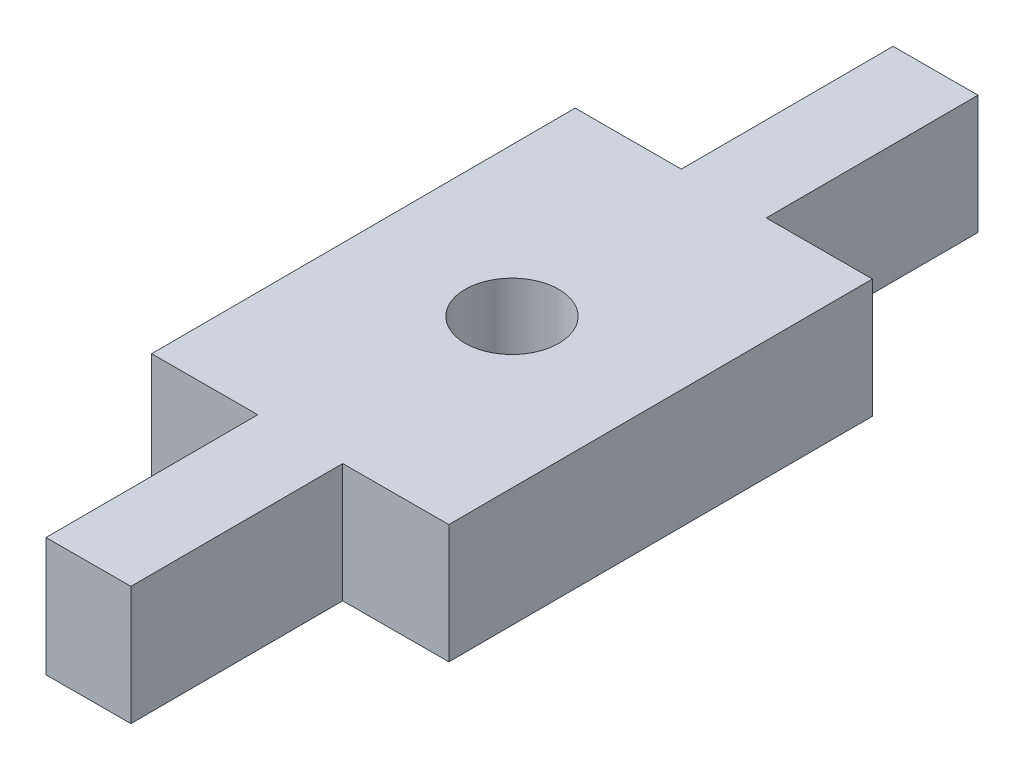
from build123d import *

# Parameters (mm, degrees)
SKETCH1_R           = 1.25
BOSS_EXTRUDE1_DEPTH = 3.175


with BuildPart() as part:
    # Sketch1 → Boss-Extrude1 (new body)
    with BuildSketch(Plane(origin=(0, 0, 0), x_dir=(1, 0, 0), z_dir=(0, 1, 0))):
        Polygon((-1.118043587, -5.668782879), (-1.105681336, -11.33506329), (1.156720386, -11.330127358), (1.144358255, -5.663902003), (3.972550508, -5.657731673), (3.947826292, 5.674698742), (1.119809509, 5.668528795), (1.1074474, 11.334744509), (-1.154834519, 11.329808838), (-1.14247241, 5.663592957), (-3.970788681, 5.657422357), (-3.946064585, -5.674952836), align=None)
        Circle(SKETCH1_R, mode=Mode.SUBTRACT)
    extrude(amount=BOSS_EXTRUDE1_DEPTH)


solid = part.part
